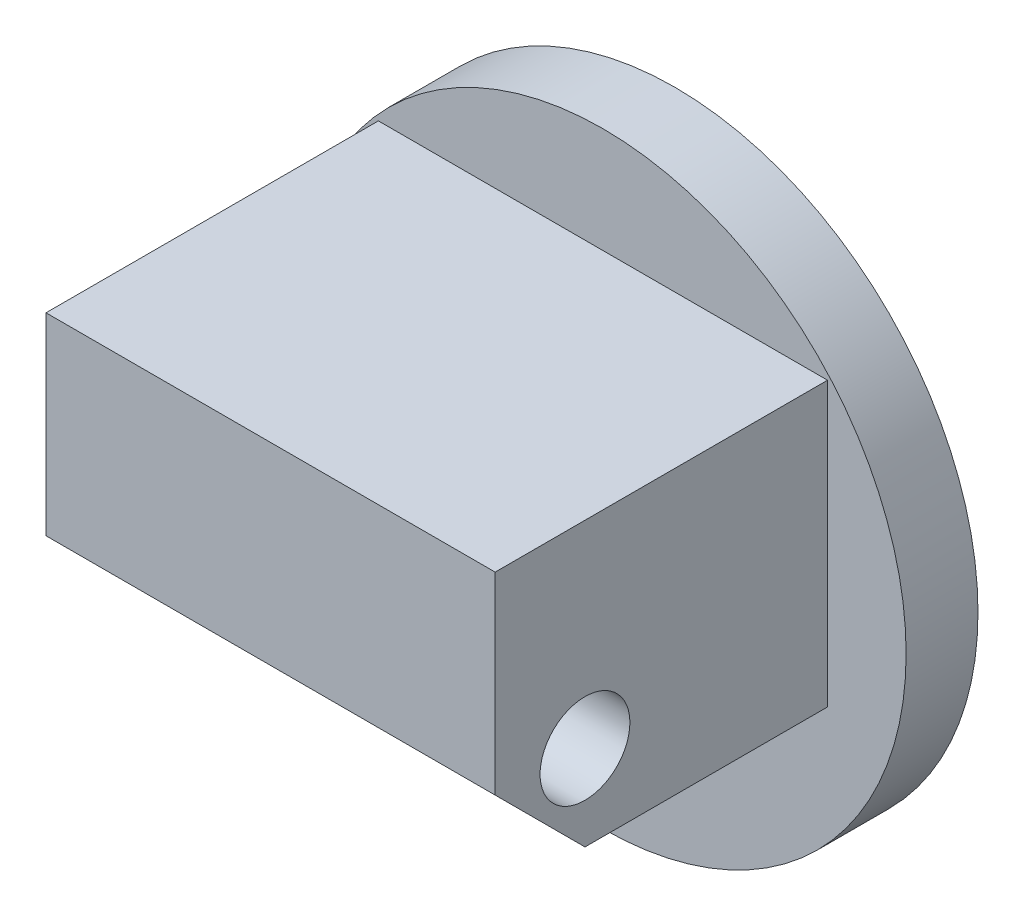
from build123d import *

# Parameters (mm, degrees)
SKETCH1_R               = 6.75
BOSS_EXTRUDE1_DEPTH     = 9
SKETCH2_R               = 5
BOSS_EXTRUDE2_DEPTH     = 1
CUT_EXTRUDE1_DEPTH      = 14.119641763
CUT_EXTRUDE1_DEPTH_BACK = 14.119641763
SKETCH3_W               = 1.75
SKETCH3_H               = 7.4
CUT_EXTRUDE2_DEPTH      = 14.119641763
CUT_EXTRUDE2_DEPTH_BACK = 14.119641763
SKETCH4_W               = 7.4
SKETCH4_H               = 2.35
SKETCH4_H_2             = 4.85
CUT_EXTRUDE3_DEPTH      = 17.267298485
CUT_EXTRUDE3_DEPTH_BACK = 17.267298485
SKETCH5_R               = 1
CHAMFER1_SIZE           = 2


with BuildPart() as part:
    # Sketch1 → Boss-Extrude1 (new body)
    with BuildSketch(Plane.XY):
        Circle(SKETCH1_R)
    extrude(amount=BOSS_EXTRUDE1_DEPTH)

    # Sketch2 → Boss-Extrude2 (add)
    with BuildSketch(Plane(origin=(0, 0, 0), x_dir=(-1, 0, 0), z_dir=(0, 0, -1))):
        Circle(SKETCH2_R)
    extrude(amount=BOSS_EXTRUDE2_DEPTH)

    # Sketch3 → Cut-Extrude1 (cut, two sides: drawn at the far end of the back side and taken through both)
    with BuildSketch(Plane(origin=(0, 0, 0), x_dir=(1, 0, 0), z_dir=(0, 1, 0)).offset(-CUT_EXTRUDE1_DEPTH_BACK)):
        with Locations((-5.875, -5.3)):
            Rectangle(SKETCH3_W, SKETCH3_H)
        with Locations((5.875, -5.3)):
            Rectangle(SKETCH3_W, SKETCH3_H)
    extrude(amount=CUT_EXTRUDE1_DEPTH + CUT_EXTRUDE1_DEPTH_BACK, mode=Mode.SUBTRACT)

    # Sketch4 → Cut-Extrude2 (cut, two sides: drawn at the far end of the back side and taken through both)
    with BuildSketch(Plane(origin=(0, 0, 0), x_dir=(0, 0, -1), z_dir=(1, 0, 0)).offset(-CUT_EXTRUDE2_DEPTH_BACK)):
        with Locations((-5.3, 5.575)):
            Rectangle(SKETCH4_W, SKETCH4_H)
        with Locations((-5.3, -4.325)):
            Rectangle(SKETCH4_W, SKETCH4_H_2)
    extrude(amount=CUT_EXTRUDE2_DEPTH + CUT_EXTRUDE2_DEPTH_BACK, mode=Mode.SUBTRACT)

    # Sketch5 → Cut-Extrude3 (cut, two sides: drawn at the far end of the back side and taken through both)
    with BuildSketch(Plane(origin=(5, 0, 0), x_dir=(0, 0, -1), z_dir=(1, 0, 0)).offset(-CUT_EXTRUDE3_DEPTH_BACK)):
        with Locations((-7, 0)):
            Circle(SKETCH5_R)
    extrude(amount=CUT_EXTRUDE3_DEPTH + CUT_EXTRUDE3_DEPTH_BACK, mode=Mode.SUBTRACT)

    # Chamfer1
    chamfer1_edges = [part.edges().sort_by_distance(p)[0] for p in [
        (0, -1.9, 9),
    ]]
    chamfer(chamfer1_edges, length=CHAMFER1_SIZE)


solid = part.part
